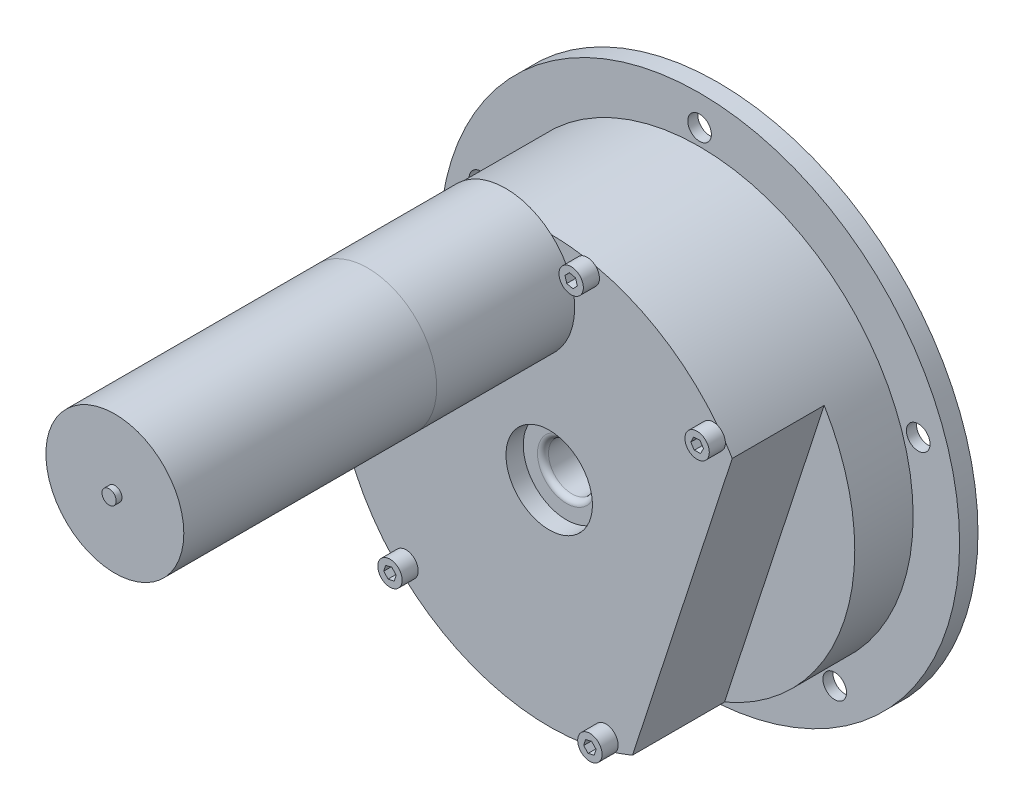
from build123d import *

# Parameters (mm, degrees)
FILLET1_R          = 1.524
SKETCH3_R          = 56.007
EXTRUDE1_DEPTH     = 2.6416
EXTRUDE3_REACH     = 111.729
SKETCH5_R          = 3.2639
CHAMFER1_SIZE      = 3.9878
CHAMFER1_SIZE2     = 2.302357403
EXTRUDE4_DEPTH     = 25.4
SKETCH7_R          = 19.05
EXTRUDE5_DEPTH     = 107.95
SKETCH9_R          = 3.3655
EXTRUDE6_DEPTH     = 4.445
SKETCH10_R         = 1.9685
EXTRUDE7_DEPTH     = 24.765
CUT_EXTRUDE1_START = 1.5875
SKETCH15_R         = 1.9685
CUT_EXTRUDE1_DEPTH = 184.356487103


with BuildPart() as part:
    # Sketch2 → Revolve1 (revolve)
    with BuildSketch(Plane(origin=(0, 0, 0), x_dir=(0, 0, -1), z_dir=(1, 0, 0))):
        Polygon((0, 6.477), (0, 71.8185), (-5.08, 71.8185), (-5.08, 58.9915), (-46.609, 58.9915), (-46.609, 11.938), (-41.8465, 11.938), (-41.8465, 6.477), align=None)
    revolve(axis=Axis((0, 0, 46.609), (0, 0, -1)))

    # Fillet1
    fillet1_edges = [part.edges().sort_by_distance(p)[0] for p in [
        (0, -6.477, 41.8465),
    ]]
    fillet(fillet1_edges, radius=FILLET1_R)

    # Sketch3 → Extrude1 (cut)
    with BuildSketch(Plane(origin=(0, 0, 0), x_dir=(-1, 0, 0), z_dir=(0, 0, -1))):
        Circle(SKETCH3_R)
    extrude(amount=-EXTRUDE1_DEPTH, mode=Mode.SUBTRACT)

    # Sketch5 → Extrude3 (cut, up to next)
    with BuildSketch(Plane.XY.offset(5.08), mode=Mode.PRIVATE) as extrude3_sk1:
        with Locations((0, 63.5)):
            Circle(SKETCH5_R)
    extrude3_tool1 = extrude(extrude3_sk1.sketch, amount=-EXTRUDE3_REACH, mode=Mode.PRIVATE) & part.part
    # Sketch5 → Extrude3 (cut, up to next)
    with BuildSketch(Plane.XY.offset(5.08), mode=Mode.PRIVATE) as extrude3_sk2:
        with Locations((60.392088785, 19.622579143)):
            Circle(SKETCH5_R)
    extrude3_tool2 = extrude(extrude3_sk2.sketch, amount=-EXTRUDE3_REACH, mode=Mode.PRIVATE) & part.part
    # Sketch5 → Extrude3 (cut, up to next)
    with BuildSketch(Plane.XY.offset(5.08), mode=Mode.PRIVATE) as extrude3_sk3:
        with Locations((37.324363521, -51.372579143)):
            Circle(SKETCH5_R)
    extrude3_tool3 = extrude(extrude3_sk3.sketch, amount=-EXTRUDE3_REACH, mode=Mode.PRIVATE) & part.part
    # Sketch5 → Extrude3 (cut, up to next)
    with BuildSketch(Plane.XY.offset(5.08), mode=Mode.PRIVATE) as extrude3_sk4:
        with Locations((-37.324363521, -51.372579143)):
            Circle(SKETCH5_R)
    extrude3_tool4 = extrude(extrude3_sk4.sketch, amount=-EXTRUDE3_REACH, mode=Mode.PRIVATE) & part.part
    # Sketch5 → Extrude3 (cut, up to next)
    with BuildSketch(Plane.XY.offset(5.08), mode=Mode.PRIVATE) as extrude3_sk5:
        with Locations((-60.392088785, 19.622579143)):
            Circle(SKETCH5_R)
    extrude3_tool5 = extrude(extrude3_sk5.sketch, amount=-EXTRUDE3_REACH, mode=Mode.PRIVATE) & part.part
    add(extrude3_tool1.solids().sort_by_distance((0, 63.5, 5.08))[0], mode=Mode.SUBTRACT)
    add(extrude3_tool2.solids().sort_by_distance((60.392089, 19.622579, 5.08))[0], mode=Mode.SUBTRACT)
    add(extrude3_tool3.solids().sort_by_distance((37.324364, -51.372579, 5.08))[0], mode=Mode.SUBTRACT)
    add(extrude3_tool4.solids().sort_by_distance((-37.324364, -51.372579, 5.08))[0], mode=Mode.SUBTRACT)
    add(extrude3_tool5.solids().sort_by_distance((-60.392089, 19.622579, 5.08))[0], mode=Mode.SUBTRACT)

    # Chamfer1
    chamfer1_edges = [part.edges().sort_by_distance(p)[0] for p in [
        (34.060463521, -51.372579143, 0),
        (-40.588263521, -51.372579143, 0),
        (-63.655988785, 19.622579143, 0),
        (-3.2639, 63.5, 0),
        (57.128188785, 19.622579143, 0),
    ]]
    chamfer1_side = [part.faces().sort_by_distance(p)[0] for p in [
        (0, -69.787166065, 0),
    ]]
    chamfer(chamfer1_edges, length=CHAMFER1_SIZE, length2=CHAMFER1_SIZE2, reference=chamfer1_side[0])

    # Sketch6 → Extrude4 (cut)
    with BuildSketch(Plane.XY.offset(46.609)):
        Polygon((50.54556585, 30.416160921), (23.014050942, -54.317129264), (47.170886456, -62.166160921), (74.702401364, 22.567129264), align=None)
    extrude(amount=-EXTRUDE4_DEPTH, mode=Mode.SUBTRACT)

    # Sketch7 → Extrude5 (add)
    with BuildSketch(Plane.XY.offset(46.609)):
        with Locations((-12.023794238, 44.70269952)):
            Circle(SKETCH7_R)
    extrude(amount=EXTRUDE5_DEPTH)

    # Sketch9 → Extrude6 (add)
    # profile 1 of 5: a face of its own
    with BuildSketch(Plane.XY.offset(46.609)):
        with Locations((45.289737364, 33.164222372)):
            Circle(SKETCH9_R)
        Polygon((46.260636305, 31.696529201), (47.046246406, 33.271198934), (46.075347464, 34.738892106), (44.318838422, 34.631915543), (43.533228322, 33.057245809), (44.504127263, 31.589552638), align=None, mode=Mode.SUBTRACT)
    # profile 2 of 5: a face of its own
    with BuildSketch(Plane.XY.offset(46.609)):
        with Locations((10.504871796, 55.142303403)):
            Circle(SKETCH9_R)
        Polygon((12.215906667, 54.731052055), (11.716543346, 56.418477394), (10.005508475, 56.829728741), (8.793836925, 55.55355475), (9.293200246, 53.866129412), (11.004235117, 53.454878064), align=None, mode=Mode.SUBTRACT)
    # profile 3 of 5: a face of its own
    with BuildSketch(Plane.XY.offset(46.609)):
        with Locations((15.674172573, -53.901264087)):
            Circle(SKETCH9_R)
        Polygon((13.962925135, -54.311630029), (15.173936185, -55.588430811), (16.885183622, -55.178064869), (17.38542001, -53.490898144), (16.174408961, -52.214097362), (14.463161523, -52.624463305), align=None, mode=Mode.SUBTRACT)
    # profile 4 of 5: a face of its own
    with BuildSketch(Plane.XY.offset(46.609)):
        with Locations((-56.011502863, 3.706413765)):
            Circle(SKETCH9_R)
        Polygon((-55.811839617, 5.454813773), (-57.425830063, 4.753527212), (-57.625493309, 3.005127204), (-56.211166109, 1.958013757), (-54.597175663, 2.659300318), (-54.397512417, 4.407700326), align=None, mode=Mode.SUBTRACT)
    # profile 5 of 5: a face of its own
    with BuildSketch(Plane.XY.offset(46.609)):
        with Locations((-39.544118158, -39.840791598)):
            Circle(SKETCH9_R)
        Polygon((-40.732661518, -38.543050222), (-41.262266837, -40.221229654), (-40.073723476, -41.51897103), (-38.355574797, -41.138532974), (-37.825969478, -39.460353542), (-39.014512839, -38.162612166), align=None, mode=Mode.SUBTRACT)
    extrude(amount=EXTRUDE6_DEPTH)

    # Sketch10 → Extrude7 (add)
    with BuildSketch(Plane.XY.offset(154.559)):
        with Locations((-12.023794238, 44.70269952)):
            Circle(SKETCH10_R)
    extrude(amount=EXTRUDE7_DEPTH)

    # Sketch15 → Cut-Extrude1 (cut, through all)
    with BuildSketch(Plane.XY.offset(154.559).offset(CUT_EXTRUDE1_START)):
        with Locations((-12.023794238, 44.70269952)):
            Circle(SKETCH15_R)
    extrude(amount=CUT_EXTRUDE1_DEPTH, mode=Mode.SUBTRACT)


solid = part.part
